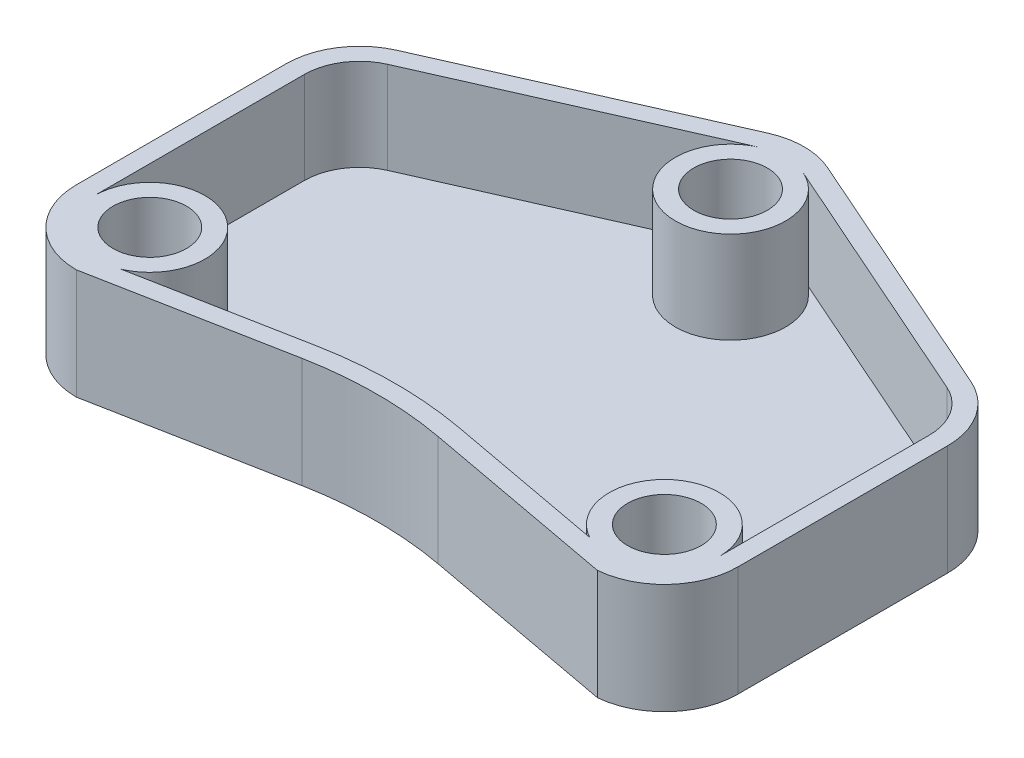
from build123d import *

# Parameters (mm, degrees)
SKETCH1_R           = 10
BOSS_EXTRUDE1_DEPTH = 30
SHELL3_START        = 5
SHELL3_DEPTH        = 25


# Read off the part's stored shape, not the designer's step: Shell3
with BuildPart() as part:
    # Sketch1 → Boss-Extrude1 (new body)
    with BuildSketch(Plane(origin=(0, 0, 0), x_dir=(1, 0, 0), z_dir=(0, 1, 0))):
        with BuildLine():
            Line((90, 0), (90, 57.047137228))
            ThreePointArc((90, 57.047137228), (86.75954181, 67.961245451), (78.088224169, 75.338682537))
            Line((78.088224169, 75.338682537), (8.088224169, 106.291545309))
            ThreePointArc((8.088224169, 106.291545309), (0, 108), (-8.088224169, 106.291545309))
            Line((-8.088224169, 106.291545309), (-78.088224169, 75.338682537))
            ThreePointArc((-78.088224169, 75.338682537), (-86.75954181, 67.961245451), (-90, 57.047137228))
            Line((-90, 57.047137228), (-90, 0))
            ThreePointArc((-90, 0), (-84.142135624, -14.142135624), (-70, -20))
            Line((-70, -20), (-18.49195659, -10.161261295))
            ThreePointArc((-18.49195659, -10.161261295), (0.004664589, -8.385754022), (18.510453887, -10.063008789))
            Line((18.510453887, -10.063008789), (71.68950902, -19.928511216))
            ThreePointArc((71.68950902, -19.928511216), (84.727358561, -13.531626281), (90, 0))
        make_face()
        with Locations(Location((-70, 0, 0), (0, 0, 270))):
            Circle(SKETCH1_R, mode=Mode.SUBTRACT)
        with Locations(Location((70, 0, 0), (0, 0, 270))):
            Circle(SKETCH1_R, mode=Mode.SUBTRACT)
        with Locations(Location((0, 88, 0), (0, 0, 270))):
            Circle(SKETCH1_R, mode=Mode.SUBTRACT)
    extrude(amount=BOSS_EXTRUDE1_DEPTH)

    # Shell3 outline → Shell3 (cut)
    with BuildSketch(Plane(origin=(0, 0, 0), x_dir=(1, 0, 0), z_dir=(0, 1, 0)).offset(SHELL3_START)):
        with BuildLine():
            Line((-85, 57.047137228), (-85, 0))
            ThreePointArc((-85, 0), (-61.754503332, 12.530434338), (-64.065095374, -13.775953944))
            Line((-64.065095374, -13.775953944), (-19.430064103, -5.250054285))
            ThreePointArc((-19.430064103, -5.250054285), (-0.008611865, -3.385771649), (19.422466898, -5.146889154))
            Line((19.422466898, -5.146889154), (62.898194489, -13.212280594))
            ThreePointArc((62.898194489, -13.212280594), (62.303477495, 12.874919081), (85, 0))
            Line((85, 0), (85, 57.047137228))
            ThreePointArc((85, 57.047137228), (82.569656358, 65.232718395), (76.066168127, 70.765796209))
            Line((76.066168127, 70.765796209), (6.066168127, 101.718658982))
            ThreePointArc((6.066168127, 101.718658982), (0, 73), (-6.066168127, 101.718658982))
            Line((-6.066168127, 101.718658982), (-76.066168127, 70.765796209))
            ThreePointArc((-76.066168127, 70.765796209), (-82.569656358, 65.232718395), (-85, 57.047137228))
        make_face()
    extrude(amount=SHELL3_DEPTH, mode=Mode.SUBTRACT)


solid = part.part
